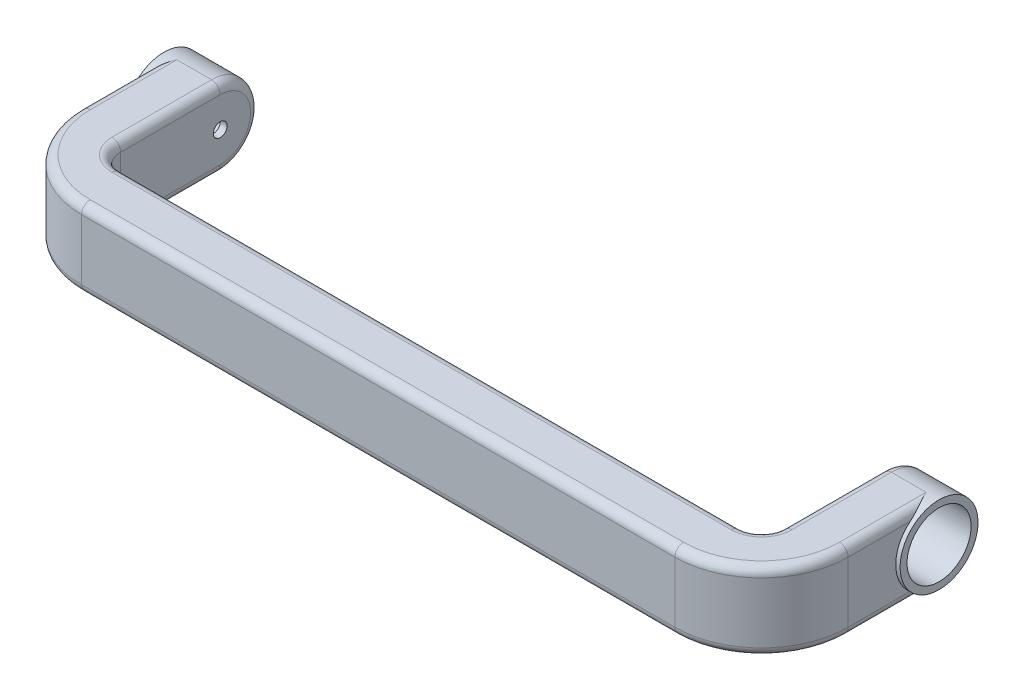
from build123d import *

# Parameters (mm, degrees)
SKETCH1_W           = 153
SKETCH1_H           = 18
BOSS_EXTRUDE1_DEPTH = 12
BOSS_EXTRUDE2_START = -12
SKETCH2_W           = 12
SKETCH2_H           = 18
BOSS_EXTRUDE2_DEPTH = 40
BOSS_EXTRUDE3_START = -12
SKETCH3_R           = 9
BOSS_EXTRUDE3_DEPTH = 13
SKETCH4_R           = 7.4
CUT_EXTRUDE1_DEPTH  = 11.4
SKETCH5_R           = 1.6
CUT_EXTRUDE2_DEPTH  = 172.871347234
CUT_EXTRUDE4_START  = -11.4
SKETCH9_R           = 7.4
CUT_EXTRUDE4_DEPTH  = 11.4
FILLET1_R           = 20
FILLET2_R           = 5
FILLET3_R           = 2


with BuildPart() as part:
    # Sketch1 → Boss-Extrude1 (new body)
    with BuildSketch(Plane.XY):
        Rectangle(SKETCH1_W, SKETCH1_H)
    extrude(amount=BOSS_EXTRUDE1_DEPTH)

    # Sketch2 → Boss-Extrude2 (add)
    with BuildSketch(Plane(origin=(0, 0, 0), x_dir=(-1, 0, 0), z_dir=(0, 0, -1)).offset(BOSS_EXTRUDE2_START)):
        with Locations((82.5, 0)):
            Rectangle(SKETCH2_W, SKETCH2_H)
    boss_extrude2 = extrude(amount=BOSS_EXTRUDE2_DEPTH)

    # Sketch3 → Boss-Extrude3 (add)
    with BuildSketch(Plane.ZY.offset(88.5).offset(BOSS_EXTRUDE3_START)):
        with Locations((-28, 0)):
            Circle(SKETCH3_R)
    boss_extrude3 = extrude(amount=BOSS_EXTRUDE3_DEPTH)

    # Mirror1: Boss-Extrude2, Boss-Extrude3 across plane
    add(boss_extrude2.mirror(Plane(origin=(0, 0, 0), x_dir=(0, 0, 1), z_dir=(1, 0, 0))))
    add(boss_extrude3.mirror(Plane(origin=(0, 0, 0), x_dir=(0, 0, 1), z_dir=(1, 0, 0))))

    # Sketch4 → Cut-Extrude1 (cut)
    with BuildSketch(Plane.ZY.offset(89.5)):
        with Locations((-28, 0)):
            Circle(SKETCH4_R)
    extrude(amount=-CUT_EXTRUDE1_DEPTH, mode=Mode.SUBTRACT)

    # Sketch5 → Cut-Extrude2 (cut, through all)
    with BuildSketch(Plane.ZY.offset(78.1)):
        with Locations((-28, 0)):
            Circle(SKETCH5_R)
    extrude(amount=-CUT_EXTRUDE2_DEPTH, mode=Mode.SUBTRACT)

    # Sketch9 → Cut-Extrude4 (cut)
    with BuildSketch(Plane(origin=(89.5, 0, 0), x_dir=(0, 0, -1), z_dir=(1, 0, 0)).offset(CUT_EXTRUDE4_START)):
        with Locations(Location((28, 0, 0), (0, 0, 180))):
            Circle(SKETCH9_R)
    extrude(amount=CUT_EXTRUDE4_DEPTH, mode=Mode.SUBTRACT)

    # Fillet1
    fillet1_edges = [part.edges().sort_by_distance(p)[0] for p in [
        (-88.5, 0, 12),
        (88.5, 0, 12),
    ]]
    fillet(fillet1_edges, radius=FILLET1_R)

    # Fillet2
    fillet2_edges = [part.edges().sort_by_distance(p)[0] for p in [
        (76.5, 0, 0),
        (-76.5, 0, 0),
    ]]
    fillet(fillet2_edges, radius=FILLET2_R)

    # Fillet3
    # the kernel refuses this fillet: 2 mm, written as the material it takes off along each edge
    with BuildSketch(Plane(origin=(-76.5, 0, -28), x_dir=(0, 1, 0), z_dir=(0, 0, 1))) as fillet3_piece_1:
        with BuildLine():
            CenterArc((9 - FILLET3_R, FILLET3_R), FILLET3_R, 270, 90)
            Line((9, FILLET3_R), (9, 0))
            Line((9, 0), (9 - FILLET3_R, 0))
        make_face()
    revolve(axis=Axis((-76.5, 0, -28), (-1, 0, 0)), revolution_arc=180, mode=Mode.SUBTRACT)
    with BuildSketch(Plane(origin=(76.5, 0, -28), x_dir=(0, 1, 0), z_dir=(0, 0, 1))) as fillet3_piece_2:
        with BuildLine():
            CenterArc((9 - FILLET3_R, -FILLET3_R), FILLET3_R, 0, 90)
            Line((9, -FILLET3_R), (9, 0))
            Line((9, 0), (9 - FILLET3_R, 0))
        make_face()
    revolve(axis=Axis((76.5, 0, -28), (-1, 0, 0)), revolution_arc=180, mode=Mode.SUBTRACT)
    with BuildSketch(Plane(origin=(68.5, 9, 12), x_dir=(0, -1, 0), z_dir=(-1, 0, 0)), Plane(origin=(68.5, -9, 12), x_dir=(0, 0, -1), z_dir=(-1, 0, 0))) as fillet3_piece_3:
        with BuildLine():
            CenterArc((FILLET3_R, -FILLET3_R), FILLET3_R, 90, 90)
            Line((0, -FILLET3_R), (0, 0))
            Line((0, 0), (FILLET3_R, 0))
        make_face()
    extrude(amount=137, mode=Mode.SUBTRACT)
    with BuildSketch(Plane(origin=(-88.5, 9, -8), x_dir=(0, -1, 0), z_dir=(0, 0, -1))) as fillet3_piece_4_section:
        with BuildLine():
            CenterArc((FILLET3_R, -FILLET3_R), FILLET3_R, 90, 90)
            Line((0, -FILLET3_R), (0, 0))
            Line((0, 0), (FILLET3_R, 0))
        make_face()
    fillet3_piece_4 = extrude(amount=25, mode=Mode.PRIVATE)
    fillet3_piece_4 = fillet3_piece_4 - Plane(origin=(-88.080537714, 0, -28), x_dir=(0, 0, 1), z_dir=(1, 0, 0)) * Cylinder(9, 59, mode=Mode.PRIVATE)
    add(fillet3_piece_4, mode=Mode.SUBTRACT)
    with BuildSketch(Plane(origin=(88.5, 9, -8), x_dir=(0, -1, 0), z_dir=(0, 0, -1))) as fillet3_piece_5_section:
        with BuildLine():
            CenterArc((FILLET3_R, FILLET3_R), FILLET3_R, 180, 90)
            Line((0, FILLET3_R), (0, 0))
            Line((0, 0), (FILLET3_R, 0))
        make_face()
    fillet3_piece_5 = extrude(amount=25, mode=Mode.PRIVATE)
    fillet3_piece_5 = fillet3_piece_5 - Plane(origin=(88.080537714, 0, -28), x_dir=(0, 0, 1), z_dir=(-1, 0, 0)) * Cylinder(9, 59, mode=Mode.PRIVATE)
    add(fillet3_piece_5, mode=Mode.SUBTRACT)
    with BuildSketch(Plane(origin=(-68.5, 9, -8), x_dir=(-1, 0, 0), z_dir=(0, 0, -1))) as fillet3_piece_6:
        with BuildLine():
            CenterArc((20 - FILLET3_R, -FILLET3_R), FILLET3_R, 0, 90)
            Line((20 - FILLET3_R, 0), (20, 0))
            Line((20, 0), (20, -FILLET3_R))
        make_face()
    revolve(axis=Axis((-68.5, 9, -8), (0, 1, 0)), revolution_arc=90, mode=Mode.SUBTRACT)
    with BuildSketch(Plane(origin=(68.5, 9, -8), x_dir=(1, 0, 0), z_dir=(0, 0, -1))) as fillet3_piece_7:
        with BuildLine():
            CenterArc((20 - FILLET3_R, FILLET3_R), FILLET3_R, 270, 90)
            Line((20 - FILLET3_R, 0), (20, 0))
            Line((20, 0), (20, FILLET3_R))
        make_face()
    revolve(axis=Axis((68.5, 9, -8), (0, -1, 0)), revolution_arc=90, mode=Mode.SUBTRACT)
    with BuildSketch(Plane(origin=(88.5, -9, -8), x_dir=(-1, 0, 0), z_dir=(0, 0, -1))) as fillet3_piece_8_section:
        with BuildLine():
            CenterArc((FILLET3_R, FILLET3_R), FILLET3_R, 180, 90)
            Line((0, FILLET3_R), (0, 0))
            Line((0, 0), (FILLET3_R, 0))
        make_face()
    fillet3_piece_8 = extrude(amount=25, mode=Mode.PRIVATE)
    fillet3_piece_8 = fillet3_piece_8 - Plane(origin=(87.881585808, 0, -28), x_dir=(0, 0, 1), z_dir=(-1, 0, 0)) * Cylinder(9, 59, mode=Mode.PRIVATE)
    add(fillet3_piece_8, mode=Mode.SUBTRACT)
    with BuildSketch(Plane(origin=(-88.5, -9, -8), x_dir=(1, 0, 0), z_dir=(0, 0, -1))) as fillet3_piece_9_section:
        with BuildLine():
            CenterArc((FILLET3_R, -FILLET3_R), FILLET3_R, 90, 90)
            Line((0, -FILLET3_R), (0, 0))
            Line((0, 0), (FILLET3_R, 0))
        make_face()
    fillet3_piece_9 = extrude(amount=25, mode=Mode.PRIVATE)
    fillet3_piece_9 = fillet3_piece_9 - Plane(origin=(-87.881599188, 0, -28), x_dir=(0, 0, 1), z_dir=(1, 0, 0)) * Cylinder(9, 59, mode=Mode.PRIVATE)
    add(fillet3_piece_9, mode=Mode.SUBTRACT)
    with BuildSketch(Plane(origin=(-68.5, -9, -8), x_dir=(-1, 0, 0), z_dir=(0, 0, -1))) as fillet3_piece_10:
        with BuildLine():
            CenterArc((20 - FILLET3_R, FILLET3_R), FILLET3_R, 270, 90)
            Line((20, FILLET3_R), (20, 0))
            Line((20, 0), (20 - FILLET3_R, 0))
        make_face()
    revolve(axis=Axis((-68.5, -9, -8), (0, 1, 0)), revolution_arc=90, mode=Mode.SUBTRACT)
    with BuildSketch(Plane(origin=(68.5, -9, -8), x_dir=(1, 0, 0), z_dir=(0, 0, -1))) as fillet3_piece_11:
        with BuildLine():
            CenterArc((20 - FILLET3_R, -FILLET3_R), FILLET3_R, 0, 90)
            Line((20, -FILLET3_R), (20, 0))
            Line((20, 0), (20 - FILLET3_R, 0))
        make_face()
    revolve(axis=Axis((68.5, -9, -8), (0, -1, 0)), revolution_arc=90, mode=Mode.SUBTRACT)
    with BuildSketch(Plane(origin=(-76.5, -9, -5), x_dir=(-1, 0, 0), z_dir=(0, 0, -1)), Plane(origin=(-76.5, 9, -5), x_dir=(0, -1, 0), z_dir=(0, 0, -1))) as fillet3_piece_12:
        with BuildLine():
            CenterArc((FILLET3_R, FILLET3_R), FILLET3_R, 180, 90)
            Line((0, FILLET3_R), (0, 0))
            Line((0, 0), (FILLET3_R, 0))
        make_face()
    extrude(amount=23, mode=Mode.SUBTRACT)
    with BuildSketch(Plane(origin=(-71.5, 9, 0), x_dir=(0, -1, 0), z_dir=(1, 0, 0))) as fillet3_piece_13:
        with BuildLine():
            CenterArc((FILLET3_R, -FILLET3_R), FILLET3_R, 90, 90)
            Line((0, -FILLET3_R), (0, 0))
            Line((0, 0), (FILLET3_R, 0))
        make_face()
    extrude(amount=143, mode=Mode.SUBTRACT)
    with BuildSketch(Plane(origin=(71.5, -9, 0), x_dir=(0, 0, 1), z_dir=(-1, 0, 0))) as fillet3_piece_14:
        with BuildLine():
            CenterArc((FILLET3_R, FILLET3_R), FILLET3_R, 180, 90)
            Line((0, FILLET3_R), (0, 0))
            Line((0, 0), (FILLET3_R, 0))
        make_face()
    extrude(amount=143, mode=Mode.SUBTRACT)
    with BuildSketch(Plane(origin=(76.5, 9, -5), x_dir=(0, -1, 0), z_dir=(0, 0, -1)), Plane(origin=(76.5, -9, -5), x_dir=(1, 0, 0), z_dir=(0, 0, -1))) as fillet3_piece_15:
        with BuildLine():
            CenterArc((FILLET3_R, -FILLET3_R), FILLET3_R, 90, 90)
            Line((0, -FILLET3_R), (0, 0))
            Line((0, 0), (FILLET3_R, 0))
        make_face()
    extrude(amount=23, mode=Mode.SUBTRACT)
    with BuildSketch(Plane(origin=(-71.5, -9, -5), x_dir=(-1, 0, 0), z_dir=(0, 0, -1))) as fillet3_piece_16:
        with BuildLine():
            CenterArc((5 + FILLET3_R, FILLET3_R), FILLET3_R, 180, 90)
            Line((5, FILLET3_R), (5, 0))
            Line((5, 0), (5 + FILLET3_R, 0))
        make_face()
    revolve(axis=Axis((-71.5, -9, -5), (0, 1, 0)), revolution_arc=90, mode=Mode.SUBTRACT)
    with BuildSketch(Plane(origin=(-71.5, 9, -5), x_dir=(-1, 0, 0), z_dir=(0, 0, -1))) as fillet3_piece_17:
        with BuildLine():
            CenterArc((5 + FILLET3_R, -FILLET3_R), FILLET3_R, 90, 90)
            Line((5 + FILLET3_R, 0), (5, 0))
            Line((5, 0), (5, -FILLET3_R))
        make_face()
    revolve(axis=Axis((-71.5, 9, -5), (0, 1, 0)), revolution_arc=90, mode=Mode.SUBTRACT)
    with BuildSketch(Plane(origin=(71.5, 9, -5), x_dir=(0, 0, 1), z_dir=(-1, 0, 0))) as fillet3_piece_18:
        with BuildLine():
            CenterArc((5 + FILLET3_R, -FILLET3_R), FILLET3_R, 90, 90)
            Line((5 + FILLET3_R, 0), (5, 0))
            Line((5, 0), (5, -FILLET3_R))
        make_face()
    revolve(axis=Axis((71.5, 9, -5), (0, 1, 0)), revolution_arc=90, mode=Mode.SUBTRACT)
    with BuildSketch(Plane(origin=(71.5, -9, -5), x_dir=(0, 0, 1), z_dir=(-1, 0, 0))) as fillet3_piece_19:
        with BuildLine():
            CenterArc((5 + FILLET3_R, FILLET3_R), FILLET3_R, 180, 90)
            Line((5, FILLET3_R), (5, 0))
            Line((5, 0), (5 + FILLET3_R, 0))
        make_face()
    revolve(axis=Axis((71.5, -9, -5), (0, 1, 0)), revolution_arc=90, mode=Mode.SUBTRACT)


solid = part.part
